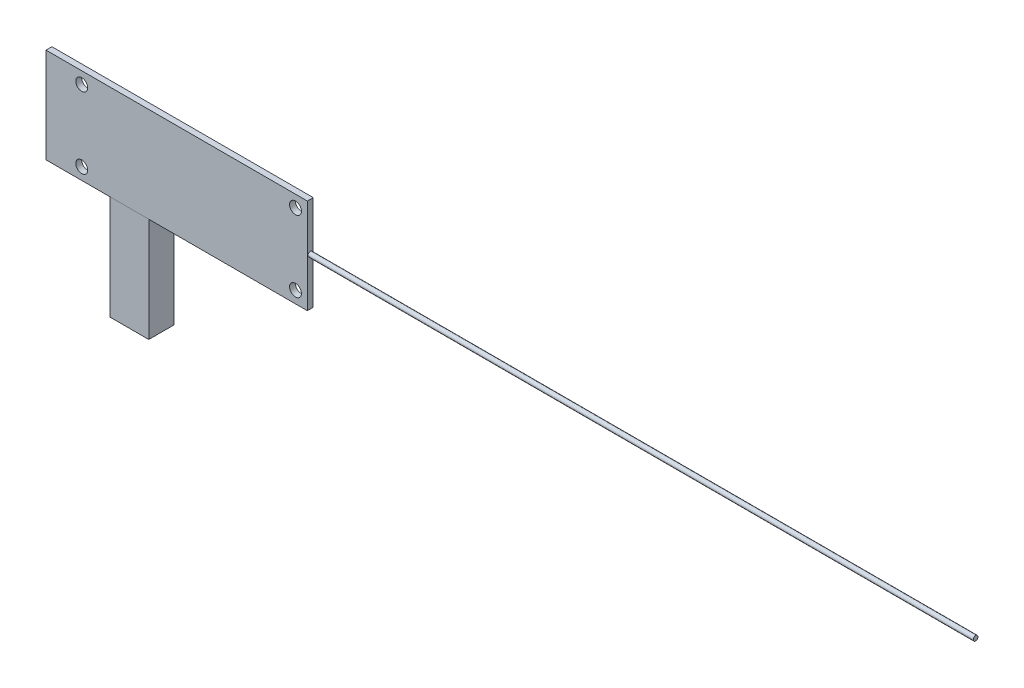
from build123d import *

# Parameters (mm, degrees)
SKETCH1_W                             = 69.85
SKETCH1_H                             = 25.4
EXTRUDE1_DEPTH                        = 1.5748
F_1_8_0_125_DIAMETER_HOLE1_AT_2_COUNT = 2
F_1_8_0_125_DIAMETER_HOLE1_AT_2_PITCH = 57.13222
SKETCH4_R                             = 0.635
BOSS_EXTRUDE1_DEPTH                   = 177.8
SKETCH5_W                             = 8.128
SKETCH5_H                             = 8.7376
USB_CONNECTOR_DEPTH                   = 4.1402
SKETCH6_W                             = 10.40639215
SKETCH6_H                             = 6.781860105
CHARGER_DEPTH                         = 27.94


with BuildPart() as part:
    # Sketch1 → Extrude1 (new body)
    with BuildSketch(Plane.XY):
        Rectangle(SKETCH1_W, SKETCH1_H)
    extrude(amount=EXTRUDE1_DEPTH)

    # Sketch3 → 1/8 (0.125) Diameter Hole1 (revolve, cut)
    with BuildSketch(Plane(origin=(-25.38222, 9.525, 1.5748), x_dir=(0, -1, 0), z_dir=(1, 0, 0))):
        Polygon((0, 0), (0, 16.955866233), (1.5875, 16.002), (1.5875, 0), align=None)
    f_1_8_0_125_diameter_hole1 = revolve(axis=Axis((-25.38222, 9.525, 7.9248), (0, 0, -1)), mode=Mode.SUBTRACT)

    # 1/8 (0.125) Diameter Hole1 at 2: 1/8 (0.125) Diameter Hole1 ×2
    with Locations(*[(i * F_1_8_0_125_DIAMETER_HOLE1_AT_2_PITCH, 0, 0) for i in range(1, F_1_8_0_125_DIAMETER_HOLE1_AT_2_COUNT)]):
        add(f_1_8_0_125_diameter_hole1, mode=Mode.SUBTRACT)

    # Mirror1: 1/8 (0.125) Diameter Hole1 across plane
    add(f_1_8_0_125_diameter_hole1.mirror(Plane.ZX), mode=Mode.SUBTRACT)

    # Mirror1 copy 1 sketch → Mirror1 copy 1 (revolve, cut)
    with BuildSketch(Plane(origin=(31.75, -9.525, 1.5748), x_dir=(0, 1, 0), z_dir=(1, 0, 0))):
        Polygon((0, 0), (0, -16.955866233), (1.5875, -16.002), (1.5875, 0), align=None)
    revolve(axis=Axis((31.75, -9.525, 7.9248), (0, 0, 1)), mode=Mode.SUBTRACT)

    # Sketch4 → Boss-Extrude1 (add)
    with BuildSketch(Plane(origin=(34.925, 0, 0), x_dir=(0, 0, -1), z_dir=(1, 0, 0))):
        with Locations((-0.772028936, 0)):
            Circle(SKETCH4_R)
    extrude(amount=BOSS_EXTRUDE1_DEPTH)

    # Sketch5 → USB Connector (add)
    with BuildSketch(Plane(origin=(0, 0, 0), x_dir=(-1, 0, 0), z_dir=(0, 0, -1))):
        with Locations((13.072066229, -8.3312)):
            Rectangle(SKETCH5_W, SKETCH5_H)
    extrude(amount=USB_CONNECTOR_DEPTH)

    # Sketch6 → Charger (add)
    with BuildSketch(Plane.XZ.offset(12.7)):
        with Locations((-12.751236003, -1.907476131)):
            Rectangle(SKETCH6_W, SKETCH6_H)
    extrude(amount=CHARGER_DEPTH)


solid = part.part
